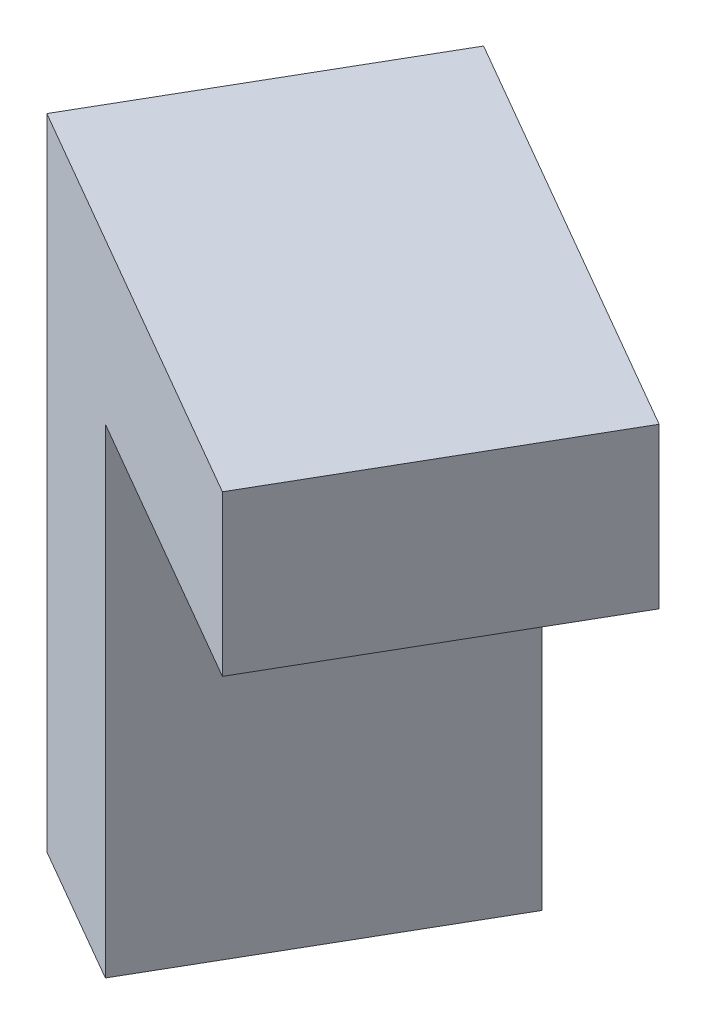
from build123d import *

# Parameters (mm, degrees)
BOSS_EXTRUDE1_DEPTH = 10


with BuildPart() as part:
    # Sketch1 → Boss-Extrude1 (new body)
    with BuildSketch(Plane(origin=(-7.5, 0, 12.990381057), x_dir=(0, -1, 0), z_dir=(-0.49999999999999994, 0, 0.8660254037844387))):
        Polygon((5, 5), (25, 5), (25, 10), (10, 10), (10, 20), (5, 20), align=None)
    extrude(amount=BOSS_EXTRUDE1_DEPTH)


solid = part.part
